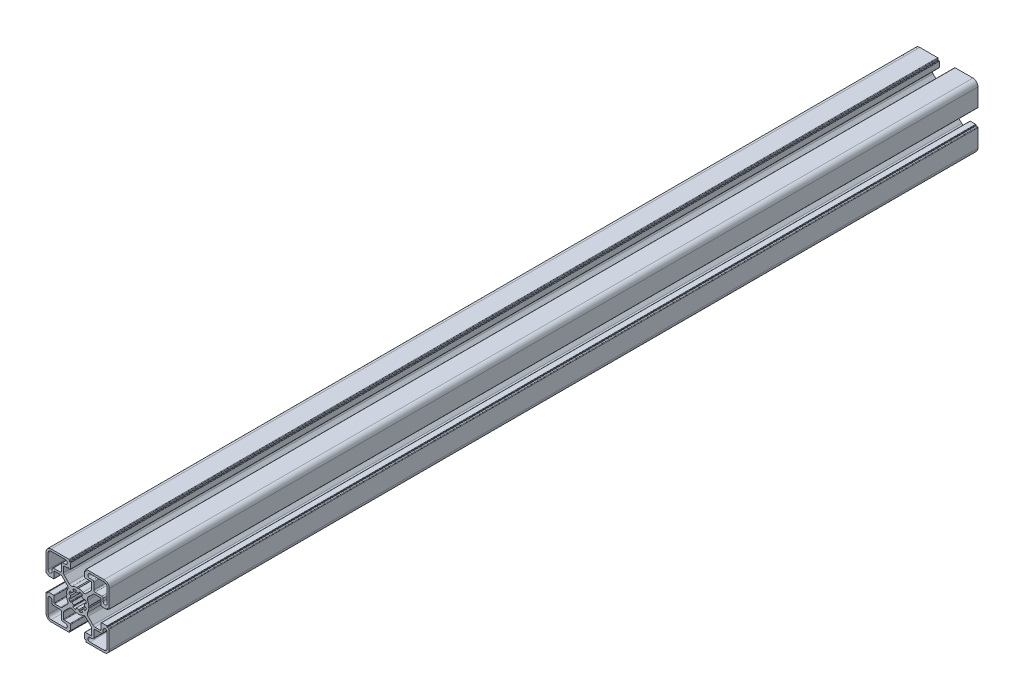
from build123d import *

# Parameters (mm, degrees)
BOSS_EXTRUDE1_DEPTH      = 1524
FILLET4_R                = 1.885
FILLET5_R                = 0.377
DELETEFACE1_START        = -1524
DELETEFACE1_DEPTH        = 3048
CUT_EXTRUDE1_DEPTH       = 1525.332148844
CIRPATTERN2_COUNT        = 3
CIRPATTERN2_ANGLE        = 180
FILLET2_R                = 0.377
FILLET3_R                = 0.1885
CUT_EXTRUDE2_DEPTH       = 3049.166087995
CUT_EXTRUDE2_DEPTH_BACK  = 3049.166087995
SKETCH5_R                = 6.375
BOSS_EXTRUDE2_DEPTH      = 1524
FILLET6_R                = 0.377
CIRPATTERN1_COUNT        = 8
FILLET6_OF_CIRPATTERN1_R = 0.377
CUT_EXTRUDE3_DEPTH       = 1525.332148844
CUT_EXTRUDE3_DEPTH_BACK  = 1525.332148844
SKETCH8_W                = 45.58785463
SKETCH8_H                = 45.645707238
CUT_EXTRUDE4_DEPTH       = 2429.76


# Read off the part's stored shape, not the designer's step: DeleteFace1
with BuildPart() as part:
    # Sketch3 → Boss-Extrude1 (new, symmetric)
    with BuildSketch(Plane.XY):
        with BuildLine():
            Line((0, -8), (0, -5))
            ThreePointArc((0, -5), (3.535533906, -3.535533906), (5, 0))
            Line((5, 0), (8, 0))
            ThreePointArc((8, 0), (7.57237156, -2.58054044), (6.335202759, -4.885202759))
            Line((6.335202759, -4.885202759), (11.5, -10.05))
            Line((11.5, -10.05), (16.7, -10.05))
            Line((16.7, -10.05), (16.7, -5))
            Line((16.7, -5), (21.05, -5))
            Line((21.05, -5), (21.05, 0))
            Line((21.05, 0), (22.5, 0))
            Line((22.5, 0), (22.5, -18.875))
            ThreePointArc((22.5, -18.875), (21.438262082, -21.438262082), (18.875, -22.5))
            Line((18.875, -22.5), (0, -22.5))
            Line((0, -22.5), (0, -21.05))
            Line((0, -21.05), (5, -21.05))
            Line((5, -21.05), (5, -16.7))
            Line((5, -16.7), (10.05, -16.7))
            Line((10.05, -16.7), (10.05, -11.5))
            Line((10.05, -11.5), (4.885202759, -6.335202759))
            ThreePointArc((4.885202759, -6.335202759), (2.58054044, -7.57237156), (0, -8))
        make_face()
        with BuildLine():
            Line((18.15, -8.79375), (18.15, -10.5575))
            ThreePointArc((18.15, -10.5575), (17.873948141, -11.223948141), (17.2075, -11.5))
            Line((17.2075, -11.5), (12.4425, -11.5))
            ThreePointArc((12.4425, -11.5), (11.776051859, -11.776051859), (11.5, -12.4425))
            Line((11.5, -12.4425), (11.5, -17.2075))
            ThreePointArc((11.5, -17.2075), (11.223948141, -17.873948141), (10.5575, -18.15))
            Line((10.5575, -18.15), (8.79375, -18.15))
            ThreePointArc((8.79375, -18.15), (7.34375, -19.6), (8.79375, -21.05))
            Line((8.79375, -21.05), (18.875, -21.05))
            ThreePointArc((18.875, -21.05), (20.412957249, -20.412957249), (21.05, -18.875))
            Line((21.05, -18.875), (21.05, -8.79375))
            ThreePointArc((21.05, -8.79375), (19.6, -7.34375), (18.15, -8.79375))
        make_face(mode=Mode.SUBTRACT)
    extrude(amount=BOSS_EXTRUDE1_DEPTH, both=True)

    # Fillet4
    fillet4_edges = [part.edges().sort_by_distance(p)[0] for p in [
        (10.05, -11.5, 0),
        (4.885202759, -6.335202759, 0),
        (6.335202759, -4.885202759, 0),
        (11.5, -10.05, 0),
    ]]
    fillet(fillet4_edges, radius=FILLET4_R)

    # Fillet5
    fillet5_edges = [part.edges().sort_by_distance(p)[0] for p in [
        (5, -21.05, 0),
        (5, -16.7, 0),
        (10.05, -16.7, 0),
        (16.7, -10.05, 0),
        (16.7, -5, 0),
        (21.05, -5, 0),
    ]]
    fillet(fillet5_edges, radius=FILLET5_R)

    # Mirror1: part across plane


with BuildPart() as part_1:
    add(part.part)
    add(part.part.mirror(Plane.ZX))

    # DeleteFace1 outline → DeleteFace1 (cut)
    with BuildSketch(Plane.XY.offset(DELETEFACE1_START)):
        with BuildLine():
            ThreePointArc((4.623, 21.05), (4.889579257, 20.939579257), (5, 20.673))
            Line((5, 20.673), (5, 21.05))
            Line((5, 21.05), (4.623, 21.05))
        make_face()
    extrude(amount=DELETEFACE1_DEPTH, mode=Mode.SUBTRACT)

    # Sketch4 → Cut-Extrude1 (cut, symmetric)
    with BuildSketch(Plane.XY):
        Polygon((5.85, 21.05), (5.85, 22.5), (0, 22.5), (-5.85, 22.5), (-5.85, 21.05), (-5, 21.05), (-5, 16.7), (5, 16.7), (5, 21.05), align=None)
    cut_extrude1 = extrude(amount=CUT_EXTRUDE1_DEPTH, both=True, mode=Mode.SUBTRACT)

    # CirPattern2: Cut-Extrude1 ×3 about axis
    cirpattern2_axis = Axis((0, 0, 1489), (0, 0, -1))
    for i in range(1, CIRPATTERN2_COUNT):
        add(cut_extrude1.rotate(cirpattern2_axis, i * CIRPATTERN2_ANGLE / (CIRPATTERN2_COUNT - 1)), mode=Mode.SUBTRACT)

    # Fillet2
    fillet2_edges = [part_1.edges().sort_by_distance(p)[0] for p in [
        (5.85, 22.5, 0),
        (22.5, 5.85, 0),
        (22.5, -5.85, 0),
        (5.85, -22.5, 0),
    ]]
    fillet(fillet2_edges, radius=FILLET2_R)

    # Fillet3
    fillet3_edges = [part_1.edges().sort_by_distance(p)[0] for p in [
        (5, 21.05, 0),
        (5.85, 21.05, 0),
        (21.05, -5, 0),
        (21.05, -5.85, 0),
        (21.05, 5, 0),
        (21.05, 5.85, 0),
        (5, -21.05, 0),
        (5.85, -21.05, 0),
    ]]
    fillet(fillet3_edges, radius=FILLET3_R)

    # Mirror2: part across plane


with BuildPart() as part_2:
    add(part_1.part)
    add(part_1.part.mirror(Plane(origin=(0, 0, 0), x_dir=(0, 0, 1), z_dir=(1, 0, 0))))

    # Sketch5 → Cut-Extrude2 (cut, two sides: drawn at the far end of the back side and taken through both)
    with BuildSketch(Plane.XY.offset(1524).offset(-CUT_EXTRUDE2_DEPTH_BACK)):
        Circle(SKETCH5_R)
        Polygon((-0.580185128, 8), (0.580185128, 8), (0, 7.59375), align=None)
        Polygon((-8, 0.580185128), (-8, -0.580185128), (-7.59375, 0), align=None)
        Polygon((8, 0.580185128), (8, -0.580185128), (7.59375, 0), align=None)
        Polygon((-0.580185128, -8), (0.580185128, -8), (0, -7.59375), align=None)
    extrude(amount=CUT_EXTRUDE2_DEPTH + CUT_EXTRUDE2_DEPTH_BACK, mode=Mode.SUBTRACT)

    # Sketch6 → Boss-Extrude2 (add, symmetric)
    with BuildSketch(Plane.XY):
        with BuildLine():
            Line((-0.97545161, -4.903926402), (-1.243700803, -6.252506163))
            ThreePointArc((-1.243700803, -6.252506163), (0, -6.375), (1.243700803, -6.252506163))
            Line((1.243700803, -6.252506163), (0.97545161, -4.903926402))
            ThreePointArc((0.97545161, -4.903926402), (0, -5), (-0.97545161, -4.903926402))
        make_face()
    boss_extrude2 = extrude(amount=BOSS_EXTRUDE2_DEPTH, both=True)

    # Fillet6
    fillet6_edges = [part_2.edges().sort_by_distance(p)[0] for p in [
        (-1.243700803, -6.252506163, 0),
        (1.243700803, -6.252506163, 0),
    ]]
    fillet(fillet6_edges, radius=FILLET6_R)

    # CirPattern1: Boss-Extrude2 ×8 about axis
    cirpattern1_axis = Axis((0, 0, 0), (0, 0, 1))
    for i in range(1, CIRPATTERN1_COUNT):
        add(boss_extrude2.rotate(cirpattern1_axis, i * 360 / CIRPATTERN1_COUNT))

    # Fillet6 of CirPattern1
    fillet6_of_cirpattern1_edges = [part_2.edges().sort_by_distance(p)[0] for p in [
        (3.541760235, -5.300618778, 0),
        (5.300618778, -3.541760235, 0),
        (6.252506163, -1.243700803, 0),
        (6.252506163, 1.243700803, 0),
        (5.300618778, 3.541760235, 0),
        (3.541760235, 5.300618778, 0),
        (1.243700803, 6.252506163, 0),
        (-1.243700803, 6.252506163, 0),
        (-3.541760235, 5.300618778, 0),
        (-5.300618778, 3.541760235, 0),
        (-6.252506163, 1.243700803, 0),
        (-6.252506163, -1.243700803, 0),
        (-5.300618778, -3.541760235, 0),
        (-3.541760235, -5.300618778, 0),
    ]]
    fillet(fillet6_of_cirpattern1_edges, radius=FILLET6_OF_CIRPATTERN1_R)

    # Sketch7 → Cut-Extrude3 (cut, two sides: drawn at the far end of the back side and taken through both)
    with BuildSketch(Plane.XY.offset(-CUT_EXTRUDE3_DEPTH_BACK)):
        Polygon((-7.031875, 16.7), (-6.596875, 17.135), (-6.161875, 16.7), align=None)
    extrude(amount=CUT_EXTRUDE3_DEPTH + CUT_EXTRUDE3_DEPTH_BACK, mode=Mode.SUBTRACT)

    # Sketch8 → Cut-Extrude4 (cut)
    with BuildSketch(Plane.XY.offset(1524)):
        Rectangle(SKETCH8_W, SKETCH8_H)
    extrude(amount=-CUT_EXTRUDE4_DEPTH, mode=Mode.SUBTRACT)


solid = part_2.part
